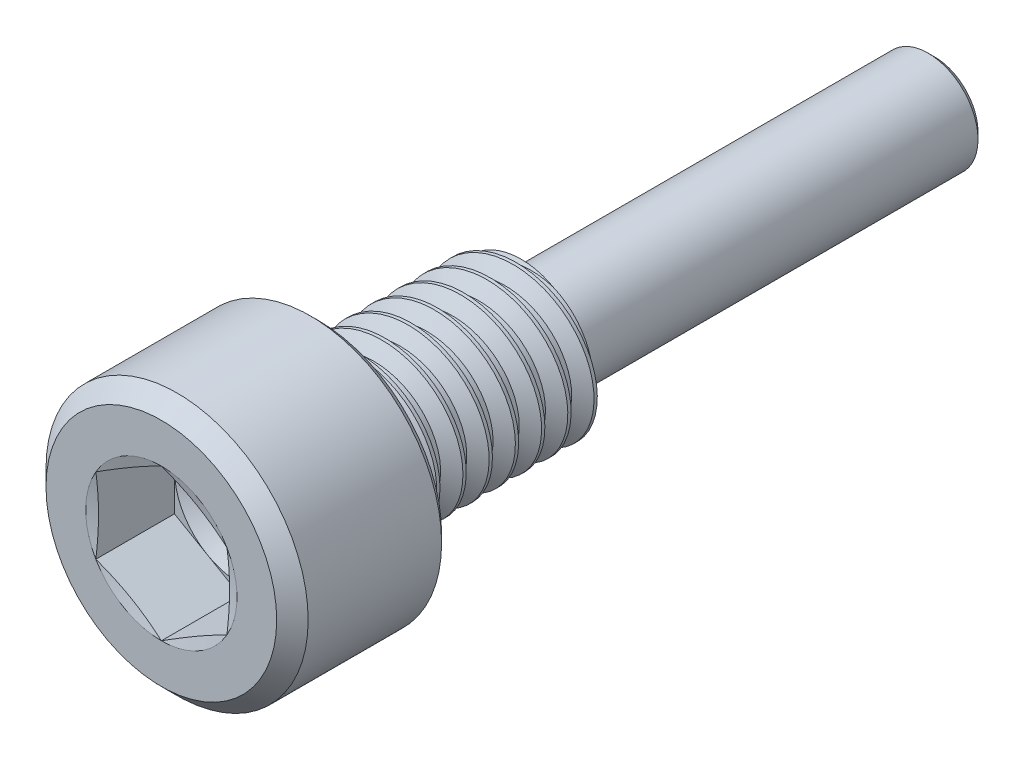
from build123d import *

# Parameters (mm, degrees)
CUT_EXTRUDE1_DEPTH      = 3
FILETAGE3_PITCH         = 1
FILETAGE3_TO            = 26.5
ESQUISSE8_R             = 4.245635267
ENL_V_MAT_EXTRU_2_DEPTH = 1.5
ESQUISSE4_OUTSIDE_W     = 18.542
ESQUISSE4_OUTSIDE_H     = 18.542
ESQUISSE4_OUTSIDE_R     = 1.9
ENL_V_MAT_EXTRU_1_DEPTH = 15.5
D_GAGEMENT_M1_61_D      = 1.8
D_GAGEMENT_M1_61_DEPTH  = 0.1
D_GAGEMENT_M1_61_TIP    = 0.540774557
CHANFREIN1_SIZE         = 0.25


with BuildPart() as part:
    # Sketch1 → Revolve1 (revolve)
    with BuildSketch(Plane(origin=(0, 0, 0), x_dir=(0, 0, -1), z_dir=(1, 0, 0)), mode=Mode.PRIVATE) as revolve1_sk:
        Polygon((0, 0), (0, 4.4), (0.6, 5), (5.69, 5), (6, 4.69), (6, 3.4), (6, 3), (6.68, 3), (30.5, 3), (31, 2.5), (31, 0), align=None)
    revolve(revolve1_sk.sketch.rotate(Axis((0, 0, 0), (0, 0, -1)), 90), axis=Axis((0, 0, 0), (0, 0, -1)))

    # Sketch2 → Cut-Extrude1 (cut)
    with BuildSketch(Plane.XY):
        Polygon((0, 2.886751346), (-2.5, 1.443375673), (-2.5, -1.443375673), (0, -2.886751346), (2.5, -1.443375673), (2.5, 1.443375673), align=None)
    extrude(amount=-CUT_EXTRUDE1_DEPTH, mode=Mode.SUBTRACT)

    # Sketch3 → Cut-Revolve2 (revolve, cut)
    with BuildSketch(Plane(origin=(0, 0, 0), x_dir=(0, 0, -1), z_dir=(1, 0, 0)), mode=Mode.PRIVATE) as cut_revolve2_sk:
        Polygon((3, 0), (3, 2.5), (4.443375673, 0), align=None)
    revolve(cut_revolve2_sk.sketch.rotate(Axis((0, 0, -3), (0, 0, -1)), 90), axis=Axis((0, 0, -3), (0, 0, -1)), mode=Mode.SUBTRACT)

    # Sketch4 → Cut-Revolve3 (revolve, cut)
    with BuildSketch(Plane(origin=(0, 0, 0), x_dir=(0, 0, -1), z_dir=(1, 0, 0))):
        Polygon((0, 2.886751346), (0, 2.5), (0.103629711, 2.5), align=None)
    revolve(axis=Axis((0, 0, 0), (0, 0, -1)), mode=Mode.SUBTRACT)

    # Filetage3: arcs per turn and ends read off the stored shape
    # Filetage3: the profile of Profil de filetage1 profile screwed along a right-hand helix through 26.5 turns, 8 arcs to a turn; built about Z, then put on its axis
    filetage3_z = Axis((0, 0, 0), (0, 0, 1))
    filetage3_corners = [(3.0003, 0, -0.000173205), (3.0003, 0, 0.875173202), (2.458734125, 0, 0.562499999), (2.458734125, 0, 0.312499999)]
    with BuildLine(mode=Mode.PRIVATE) as filetage3_profile:
        Line(filetage3_corners[0], filetage3_corners[1])
        Line(filetage3_corners[1], filetage3_corners[2])
        Line(filetage3_corners[2], filetage3_corners[3])
        Line(filetage3_corners[3], filetage3_corners[0])
    filetage3_cap = Face(filetage3_profile.wire())
    filetage3_turn_angles = [0, 22.5, 45, 67.5, 90, 112.5, 135, 157.5, 180, 202.5, 225, 247.5, 270, 292.5, 315, 337.5, 360]
    filetage3_turn_weights = [1, 0.9238795325112867, 1, 0.9238795325112867, 1, 0.9238795325112867, 1, 0.9238795325112867, 1, 0.9238795325112867, 1, 0.9238795325112867, 1, 0.9238795325112867, 1, 0.9238795325112867, 1]
    filetage3_turn_rails = [Edge.make_bspline([Vector(p[0], p[1], 0).rotate(filetage3_z, filetage3_turn_angles[k]) / filetage3_turn_weights[k] + Vector(0, 0, p[2] + FILETAGE3_PITCH * filetage3_turn_angles[k] / 360) for k in range(17)], [0, 0, 0, 1, 1, 2, 2, 3, 3, 4, 4, 5, 5, 6, 6, 7, 7, 8, 8, 8], 2, filetage3_turn_weights) for p in filetage3_corners]
    filetage3_turn_sides = [Face.make_surface_from_curves(filetage3_turn_rails[p[0]], filetage3_turn_rails[p[1]]) for p in [(0, 1), (1, 2), (2, 3), (3, 0)]]
    filetage3_last_angles = [9360, 9382.5, 9405, 9427.5, 9450, 9472.5, 9495, 9517.5, 9540]
    filetage3_last_weights = [1, 0.9238795325112867, 1, 0.9238795325112867, 1, 0.9238795325112867, 1, 0.9238795325112806, 1]
    filetage3_last_rails = [Edge.make_bspline([Vector(p[0], p[1], 0).rotate(filetage3_z, filetage3_last_angles[k]) / filetage3_last_weights[k] + Vector(0, 0, p[2] + FILETAGE3_PITCH * filetage3_last_angles[k] / 360) for k in range(9)], [0, 0, 0, 1, 1, 2, 2, 3, 3, 4, 4, 4], 2, filetage3_last_weights) for p in filetage3_corners]
    filetage3_last_sides = [Face.make_surface_from_curves(filetage3_last_rails[p[0]], filetage3_last_rails[p[1]]) for p in [(0, 1), (1, 2), (2, 3), (3, 0)]]
    filetage3 = Plane(origin=(0, 0, -32.5), x_dir=(1, 0, 0), z_dir=(0, 0, 1)) * split(Solid(Shell([*[p.moved(Location((0, 0, FILETAGE3_PITCH * i))) for i in range(26) for p in filetage3_turn_sides], *filetage3_last_sides, filetage3_cap, filetage3_cap.rotate(filetage3_z, 9540).moved(Location((0, 0, FILETAGE3_PITCH * 9540 / 360)))])), bisect_by=Plane.XY.offset(FILETAGE3_TO), keep=Keep.BOTTOM, mode=Mode.PRIVATE)
    add(filetage3, mode=Mode.SUBTRACT)

    # Esquisse8 → Enlèv. mat.-Extru.2 (cut)
    with BuildSketch(Plane(origin=(0, 0, -31), x_dir=(-1, 0, 0), z_dir=(0, 0, -1))):
        Circle(ESQUISSE8_R)
    extrude(amount=-ENL_V_MAT_EXTRU_2_DEPTH, mode=Mode.SUBTRACT)

    # Esquisse4 outside → Enlèv. mat.-Extru.1 (cut)
    with BuildSketch(Plane(origin=(0, 0, -29.5), x_dir=(-1, 0, 0), z_dir=(0, 0, -1))):
        Rectangle(ESQUISSE4_OUTSIDE_W, ESQUISSE4_OUTSIDE_H)
        with Locations(Location((0, 0, 0), (0, 0, 180))):
            Circle(ESQUISSE4_OUTSIDE_R, mode=Mode.SUBTRACT)
    extrude(amount=-ENL_V_MAT_EXTRU_1_DEPTH, mode=Mode.SUBTRACT)

    # Dégagement M1.61
    with Locations(Plane(origin=(0, 0, -29.5), x_dir=(-1, 0, 0), z_dir=(0, 0, -1))):
        with Locations((0, 0)):
            Hole(D_GAGEMENT_M1_61_D / 2, depth=D_GAGEMENT_M1_61_DEPTH)
            with Locations((0, 0, -(D_GAGEMENT_M1_61_DEPTH + D_GAGEMENT_M1_61_TIP / 2))):  # 118° drill point
                Cone(0, D_GAGEMENT_M1_61_D / 2, D_GAGEMENT_M1_61_TIP, mode=Mode.SUBTRACT)

    # Chanfrein1
    chanfrein1_edges = [part.edges().sort_by_distance(p)[0] for p in [
        (-1.9, 0, -29.5),
    ]]
    chamfer(chanfrein1_edges, length=CHANFREIN1_SIZE)


solid = part.part
